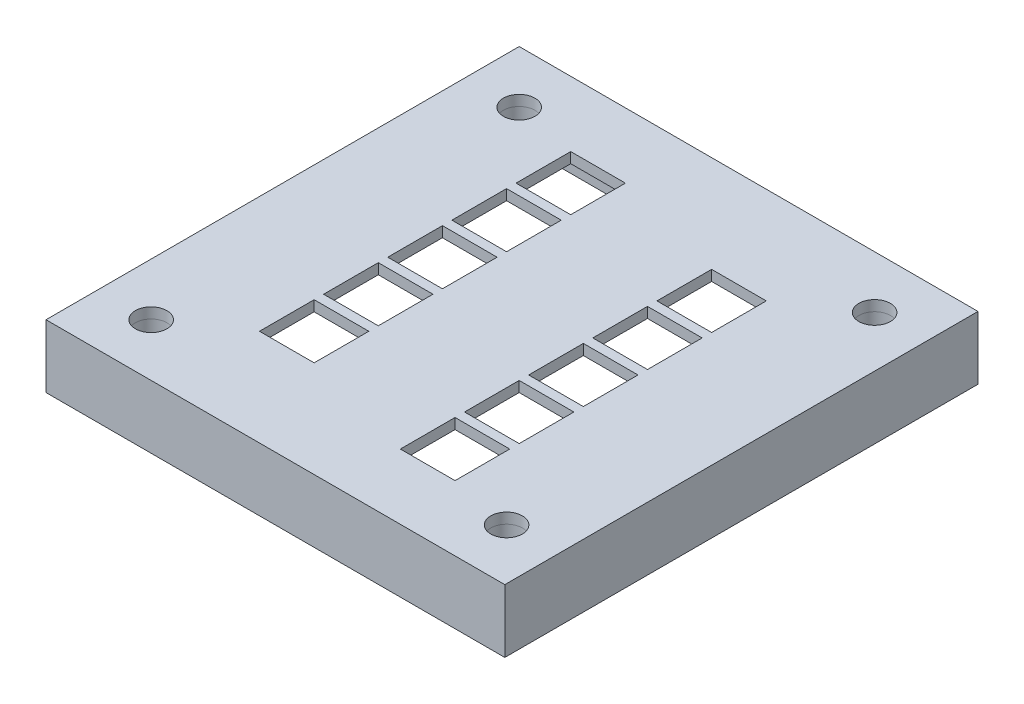
from build123d import *

# Parameters (mm, degrees)
SKETCH_1_W          = 43.6316
SKETCH_1_H          = 45
SKETCH_1_RX         = 1.5
SKETCH_1_RY         = 1.5
SKETCH_1_W_2        = 5.2
SKETCH_1_H_2        = 5.2
EXTRUDE_1_DEPTH     = 1
SKETCH_3_R          = 4
SKETCH_3_R_2        = 1.5
EXTRUDE_3_DEPTH     = 1.2
SKETCH_4_W          = 43.6316
SKETCH_4_H          = 45
SKETCH_4_W_2        = 39.6316
SKETCH_4_H_2        = 41
EXTRUDE_4_DEPTH     = 5
SKETCH_5_W          = 2
SKETCH_5_H          = 25
CUT_EXTRUDE_1_DEPTH = 5


with BuildPart() as part:
    # Эскиз1 → Бобышка-Вытянуть1 (new body)
    with BuildSketch(Plane(origin=(0, 0, 0), x_dir=(1, 0, 0), z_dir=(0, 1, 0))):
        with Locations((-0.355064662, -0.618327068)):
            Rectangle(SKETCH_1_W, SKETCH_1_H)
        with Locations(Location((-17.170864662, 16.881672932), (0, 0, 90))):
            Ellipse(SKETCH_1_RX, SKETCH_1_RY, mode=Mode.SUBTRACT)
        with Locations(Location((-17.170864662, -18.118327068), (0, 0, 90))):
            Ellipse(SKETCH_1_RX, SKETCH_1_RY, mode=Mode.SUBTRACT)
        with Locations(Location((16.629135338, 16.881672932), (0, 0, 90))):
            Ellipse(SKETCH_1_RX, SKETCH_1_RY, mode=Mode.SUBTRACT)
        with Locations(Location((16.629135338, -18.118327068), (0, 0, 90))):
            Ellipse(SKETCH_1_RX, SKETCH_1_RY, mode=Mode.SUBTRACT)
        with Locations((-8.470864662, 13.081672932)):
            Rectangle(SKETCH_1_W_2, SKETCH_1_H_2, mode=Mode.SUBTRACT)
        with Locations((-8.470864662, 6.981672932)):
            Rectangle(SKETCH_1_W_2, SKETCH_1_H_2, mode=Mode.SUBTRACT)
        with Locations((-8.470864662, 0.881672932)):
            Rectangle(SKETCH_1_W_2, SKETCH_1_H_2, mode=Mode.SUBTRACT)
        with Locations((-8.470864662, -5.218327068)):
            Rectangle(SKETCH_1_W_2, SKETCH_1_H_2, mode=Mode.SUBTRACT)
        with Locations((-8.470864662, -11.318627068)):
            Rectangle(SKETCH_1_W_2, SKETCH_1_H_2, mode=Mode.SUBTRACT)
        with Locations((7.929135338, 10.081372932)):
            Rectangle(SKETCH_1_W_2, SKETCH_1_H_2, mode=Mode.SUBTRACT)
        with Locations((7.929135338, 3.981372932)):
            Rectangle(SKETCH_1_W_2, SKETCH_1_H_2, mode=Mode.SUBTRACT)
        with Locations((7.929135338, -2.118627068)):
            Rectangle(SKETCH_1_W_2, SKETCH_1_H_2, mode=Mode.SUBTRACT)
        with Locations((7.929135338, -8.218627068)):
            Rectangle(SKETCH_1_W_2, SKETCH_1_H_2, mode=Mode.SUBTRACT)
        with Locations((7.929135338, -14.318627068)):
            Rectangle(SKETCH_1_W_2, SKETCH_1_H_2, mode=Mode.SUBTRACT)
    extrude(amount=EXTRUDE_1_DEPTH)

    # Эскиз3 → Бобышка-Вытянуть3 (add)
    # profile 1 of 4: a face of its own
    with BuildSketch(Plane.XZ):
        with Locations((-17.170864662, 18.118327068)):
            Circle(SKETCH_3_R)
        with Locations((-17.170864662, 18.118327068)):
            Circle(SKETCH_3_R_2, mode=Mode.SUBTRACT)
    # profile 2 of 4: a face of its own
    with BuildSketch(Plane.XZ):
        with Locations((16.629135338, 18.118327068)):
            Circle(SKETCH_3_R)
        with Locations((16.629135338, 18.118327068)):
            Circle(SKETCH_3_R_2, mode=Mode.SUBTRACT)
    # profile 3 of 4: a face of its own
    with BuildSketch(Plane.XZ):
        with Locations((-17.170864662, -16.881672932)):
            Circle(SKETCH_3_R)
        with Locations((-17.170864662, -16.881672932)):
            Circle(SKETCH_3_R_2, mode=Mode.SUBTRACT)
    # profile 4 of 4: a face of its own
    with BuildSketch(Plane.XZ):
        with Locations((16.629135338, -16.881672932)):
            Circle(SKETCH_3_R)
        with Locations((16.629135338, -16.881672932)):
            Circle(SKETCH_3_R_2, mode=Mode.SUBTRACT)
    extrude(amount=EXTRUDE_3_DEPTH)

    # Эскиз4 → Бобышка-Вытянуть4 (add)
    with BuildSketch(Plane.XZ):
        with Locations((-0.355064662, 0.618327068)):
            Rectangle(SKETCH_4_W, SKETCH_4_H)
        with Locations((-0.355064662, 0.618327068)):
            Rectangle(SKETCH_4_W_2, SKETCH_4_H_2, mode=Mode.SUBTRACT)
    extrude(amount=EXTRUDE_4_DEPTH)

    # Эскиз5 → Вырез-Вытянуть1 (cut)
    with BuildSketch(Plane.XZ.offset(5)):
        with Locations((-21.170864662, 0.618327068)):
            Rectangle(SKETCH_5_W, SKETCH_5_H)
    extrude(amount=-CUT_EXTRUDE_1_DEPTH, mode=Mode.SUBTRACT)


solid = part.part
